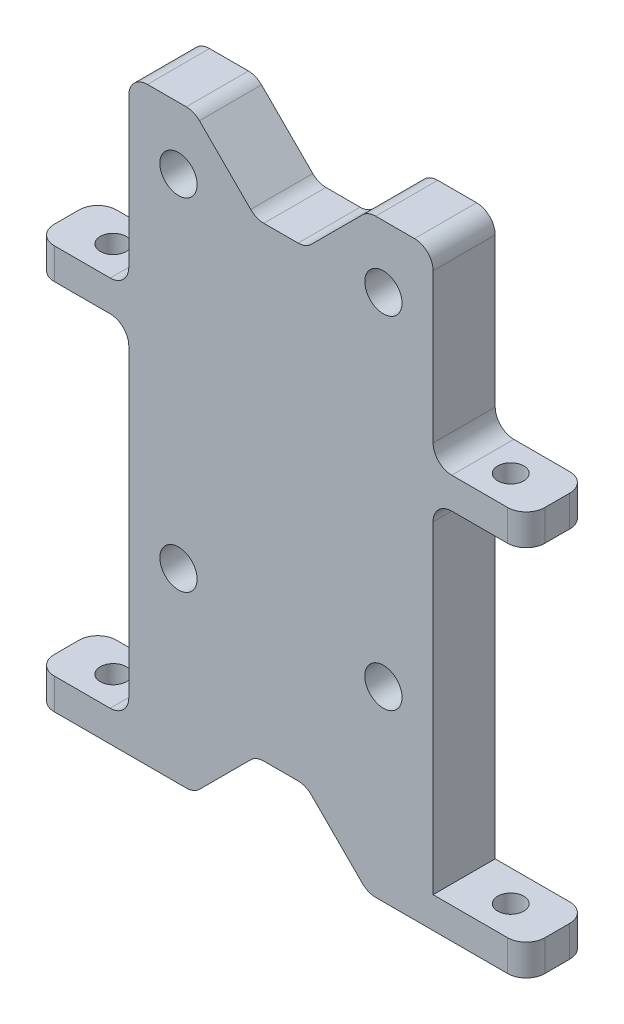
from build123d import *

# Parameters (mm, degrees)
SKETCH1_R           = 3
BOSS_EXTRUDE1_DEPTH = 10
SKETCH2_W           = 10
SKETCH2_H           = 5
BOSS_EXTRUDE2_DEPTH = 15
SKETCH3_R           = 2.1
CUT_EXTRUDE1_DEPTH  = 64
FILLET1_R           = 3
BOSS_EXTRUDE3_START = -10
BOSS_EXTRUDE3_DEPTH = 10
MIRROR3_START       = -58.554872108
MIRROR3_OUTLINE_W   = 15
MIRROR3_OUTLINE_H   = 10
MIRROR3_OUTLINE_R   = 2.1
MIRROR3_DEPTH       = 5
MIRROR3_2_DEPTH     = 10
FILLET2_R           = 3
SKETCH5_W           = 15
SKETCH5_H           = 11
CUT_EXTRUDE2_DEPTH  = 80.749736613
FILLET3_R           = 3
MIRROR4_START       = 1.445127892
MIRROR4_OUTLINE_R   = 2.1
MIRROR4_DEPTH       = 5
MIRROR4_2_DEPTH     = 10
FILLET4_R           = 3
SKETCH6_W           = 15
SKETCH6_H           = 11
CUT_EXTRUDE3_DEPTH  = 80.749736613
CUT_EXTRUDE4_DEPTH  = 80.749736613


with BuildPart() as part:
    # Sketch1 → Boss-Extrude1 (new body)
    with BuildSketch(Plane.XY):
        with BuildLine():
            Line((-24.5, 33.445127892), (-24.5, -35.554872108))
            ThreePointArc((-24.5, -35.554872108), (-23.621320344, -37.676192452), (-21.5, -38.554872108))
            Line((-21.5, -38.554872108), (-15.242640687, -38.554872108))
            ThreePointArc((-15.242640687, -38.554872108), (-14.09459039, -38.326510706), (-13.121320344, -37.676192452))
            Line((-13.121320344, -37.676192452), (-4.878679656, -29.433551765))
            ThreePointArc((-4.878679656, -29.433551765), (-3.90540961, -28.783233511), (-2.757359313, -28.554872108))
            Line((-2.757359313, -28.554872108), (2.757359313, -28.554872108))
            ThreePointArc((2.757359313, -28.554872108), (3.90540961, -28.783233511), (4.878679656, -29.433551765))
            Line((4.878679656, -29.433551765), (13.121320344, -37.676192452))
            ThreePointArc((13.121320344, -37.676192452), (14.09459039, -38.326510706), (15.242640687, -38.554872108))
            Line((15.242640687, -38.554872108), (21.5, -38.554872108))
            ThreePointArc((21.5, -38.554872108), (23.621320344, -37.676192452), (24.5, -35.554872108))
            Line((24.5, -35.554872108), (24.5, 33.445127892))
            ThreePointArc((24.5, 33.445127892), (23.621320344, 35.566448235), (21.5, 36.445127892))
            Line((21.5, 36.445127892), (15.242640687, 36.445127892))
            ThreePointArc((15.242640687, 36.445127892), (14.09459039, 36.216766489), (13.121320344, 35.566448235))
            Line((13.121320344, 35.566448235), (4.878679656, 27.323807548))
            ThreePointArc((4.878679656, 27.323807548), (3.90540961, 26.673489294), (2.757359313, 26.445127892))
            Line((2.757359313, 26.445127892), (-2.757359313, 26.445127892))
            ThreePointArc((-2.757359313, 26.445127892), (-3.90540961, 26.673489294), (-4.878679656, 27.323807548))
            Line((-4.878679656, 27.323807548), (-13.121320344, 35.566448235))
            ThreePointArc((-13.121320344, 35.566448235), (-14.09459039, 36.216766489), (-15.242640687, 36.445127892))
            Line((-15.242640687, 36.445127892), (-21.5, 36.445127892))
            ThreePointArc((-21.5, 36.445127892), (-23.621320344, 35.566448235), (-24.5, 33.445127892))
        make_face()
        with Locations((16.5, -28.554872108)):
            Circle(SKETCH1_R, mode=Mode.SUBTRACT)
        with Locations((-16.5, -28.554872108)):
            Circle(SKETCH1_R, mode=Mode.SUBTRACT)
        with Locations((16.5, 26.445127892)):
            Circle(SKETCH1_R, mode=Mode.SUBTRACT)
        with Locations((-16.5, 26.445127892)):
            Circle(SKETCH1_R, mode=Mode.SUBTRACT)
    extrude(amount=BOSS_EXTRUDE1_DEPTH)

    # Sketch2 → Boss-Extrude2 (add)
    with BuildSketch(Plane(origin=(24.5, 0, 0), x_dir=(0, 0, -1), z_dir=(1, 0, 0))):
        with Locations((-5, 23.945127892)):
            Rectangle(SKETCH2_W, SKETCH2_H)
        with Locations((-5, -26.054872108)):
            Rectangle(SKETCH2_W, SKETCH2_H)
    boss_extrude2 = extrude(amount=BOSS_EXTRUDE2_DEPTH)

    # Sketch3 → Cut-Extrude1 (cut)
    with BuildSketch(Plane(origin=(0, 26.445127892, 0), x_dir=(1, 0, 0), z_dir=(0, 1, 0))):
        with Locations(Location((32, -5, 0), (0, 0, 180))):
            Circle(SKETCH3_R)
    cut_extrude1 = extrude(amount=-CUT_EXTRUDE1_DEPTH, mode=Mode.SUBTRACT)

    # Mirror1: Boss-Extrude2, Cut-Extrude1 across plane
    add(boss_extrude2.mirror(Plane(origin=(0, 0, 0), x_dir=(0, 0, 1), z_dir=(1, 0, 0))))
    add(cut_extrude1.mirror(Plane(origin=(0, 0, 0), x_dir=(0, 0, 1), z_dir=(1, 0, 0))), mode=Mode.SUBTRACT)

    # Fillet1
    fillet1_edges = [part.edges().sort_by_distance(p)[0] for p in [
        (-39.5, 23.945127892, 10),
        (-39.5, 23.945127892, 0),
        (-24.5, 21.445127892, 5),
        (-24.5, 26.445127892, 5),
        (-39.5, -26.054872108, 10),
        (-39.5, -26.054872108, 0),
        (-24.5, -28.554872108, 5),
        (-24.5, -23.554872108, 5),
        (24.5, 21.445127892, 5),
        (24.5, 26.445127892, 5),
        (39.5, 23.945127892, 10),
        (39.5, 23.945127892, 0),
        (24.5, -28.554872108, 5),
        (24.5, -23.554872108, 5),
        (39.5, -26.054872108, 10),
        (39.5, -26.054872108, 0),
    ]]
    fillet(fillet1_edges, radius=FILLET1_R)

    # Sketch4 → Boss-Extrude3 (add)
    with BuildSketch(Plane.XY.offset(10).offset(BOSS_EXTRUDE3_START)):
        with BuildLine():
            ThreePointArc((15.242640687, -68.554872108), (14.09459039, -68.326510706), (13.121320344, -67.676192452))
            Line((13.121320344, -67.676192452), (4.878679656, -59.433551765))
            ThreePointArc((4.878679656, -59.433551765), (3.90540961, -58.783233511), (2.757359313, -58.554872108))
            Line((2.757359313, -58.554872108), (-2.757359313, -58.554872108))
            ThreePointArc((-2.757359313, -58.554872108), (-3.90540961, -58.783233511), (-4.878679656, -59.433551765))
            Line((-4.878679656, -59.433551765), (-13.121320344, -67.676192452))
            ThreePointArc((-13.121320344, -67.676192452), (-14.09459039, -68.326510706), (-15.242640687, -68.554872108))
            Line((-15.242640687, -68.554872108), (-24.5, -68.554872108))
            Line((-24.5, -68.554872108), (-24.5, -38.554872108))
            Line((-24.5, -38.554872108), (-24.5, -35.554872108))
            ThreePointArc((-24.5, -35.554872108), (-23.621320344, -37.676192452), (-21.5, -38.554872108))
            Line((-21.5, -38.554872108), (-15.242640687, -38.554872108))
            ThreePointArc((-15.242640687, -38.554872108), (-14.09459039, -38.326510706), (-13.121320344, -37.676192452))
            Line((-13.121320344, -37.676192452), (-4.878679656, -29.433551765))
            ThreePointArc((-4.878679656, -29.433551765), (-3.90540961, -28.783233511), (-2.757359313, -28.554872108))
            Line((-2.757359313, -28.554872108), (2.757359313, -28.554872108))
            ThreePointArc((2.757359313, -28.554872108), (3.90540961, -28.783233511), (4.878679656, -29.433551765))
            Line((4.878679656, -29.433551765), (13.121320344, -37.676192452))
            ThreePointArc((13.121320344, -37.676192452), (14.09459039, -38.326510706), (15.242640687, -38.554872108))
            Line((15.242640687, -38.554872108), (21.5, -38.554872108))
            ThreePointArc((21.5, -38.554872108), (23.621320344, -37.676192452), (24.5, -35.554872108))
            Line((24.5, -35.554872108), (24.5, -38.554872108))
            Line((24.5, -38.554872108), (24.5, -68.554872108))
            Line((24.5, -68.554872108), (15.242640687, -68.554872108))
        make_face()
    extrude(amount=BOSS_EXTRUDE3_DEPTH)

    # Mirror3: read off the stored shape, not the designer's step
    # Mirror3 outline → Mirror3 (add)
    # profile 1 of 2: a face of its own
    with BuildSketch(Plane(origin=(0, 0, 0), x_dir=(1, 0, 0), z_dir=(0, 1, 0)).offset(MIRROR3_START)):
        with Locations((32, -5)):
            Rectangle(MIRROR3_OUTLINE_W, MIRROR3_OUTLINE_H)
        with Locations((32, -5)):
            Circle(MIRROR3_OUTLINE_R, mode=Mode.SUBTRACT)
    # profile 2 of 2: a face of its own
    with BuildSketch(Plane(origin=(0, 0, 0), x_dir=(1, 0, 0), z_dir=(0, 1, 0)).offset(MIRROR3_START)):
        with Locations((-32, -5)):
            Rectangle(MIRROR3_OUTLINE_W, MIRROR3_OUTLINE_H)
        with Locations((-32, -5)):
            Circle(MIRROR3_OUTLINE_R, mode=Mode.SUBTRACT)
    extrude(amount=MIRROR3_DEPTH)

    # Mirror3 2 outline → Mirror3 2 (add)
    with BuildSketch(Plane.XY):
        with BuildLine():
            ThreePointArc((-24.5, -50.554872108), (-25.378679656, -52.676192452), (-27.5, -53.554872108))
            Line((-27.5, -53.554872108), (-24.5, -53.554872108))
            Line((-24.5, -53.554872108), (-24.5, -50.554872108))
        make_face()
        with BuildLine():
            Line((-24.5, -58.554872108), (-27.5, -58.554872108))
            ThreePointArc((-27.5, -58.554872108), (-25.378679657, -59.433551764), (-24.5, -61.554872108))
            Line((-24.5, -61.554872108), (-24.5, -58.554872108))
        make_face()
    extrude(amount=MIRROR3_2_DEPTH)

    # Fillet2
    fillet2_edges = [part.edges().sort_by_distance(p)[0] for p in [
        (-39.5, -56.054872108, 10),
        (-39.5, -56.054872108, 0),
        (39.5, -56.054872108, 10),
        (39.5, -56.054872108, 0),
    ]]
    fillet(fillet2_edges, radius=FILLET2_R)

    # Sketch5 → Cut-Extrude2 (cut, through all)
    with BuildSketch(Plane.XY.offset(10)):
        with Locations((-32, -26.054872108)):
            Rectangle(SKETCH5_W, SKETCH5_H)
        with Locations((32, -26.054872108)):
            Rectangle(SKETCH5_W, SKETCH5_H)
    extrude(amount=-CUT_EXTRUDE2_DEPTH, mode=Mode.SUBTRACT)

    # Fillet3
    fillet3_edges = [part.edges().sort_by_distance(p)[0] for p in [
        (-24.5, -68.554872108, 5),
        (24.5, -68.554872108, 5),
    ]]
    fillet(fillet3_edges, radius=FILLET3_R)

    # Mirror4: read off the stored shape, not the designer's step
    # Mirror4 outline → Mirror4 (add)
    with BuildSketch(Plane(origin=(0, 0, 0), x_dir=(1, 0, 0), z_dir=(0, 1, 0)).offset(MIRROR4_START)):
        with BuildLine():
            ThreePointArc((-39.5, -7), (-38.621320344, -9.121320344), (-36.5, -10))
            Line((-36.5, -10), (39.5, -10))
            Line((39.5, -10), (39.5, 0))
            Line((39.5, 0), (-36.5, 0))
            ThreePointArc((-36.5, 0), (-38.621320344, -0.878679656), (-39.5, -3))
            Line((-39.5, -3), (-39.5, -7))
        make_face()
        with Locations((-32, -5)):
            Circle(MIRROR4_OUTLINE_R, mode=Mode.SUBTRACT)
        with Locations((32, -5)):
            Circle(MIRROR4_OUTLINE_R, mode=Mode.SUBTRACT)
    extrude(amount=MIRROR4_DEPTH)

    # Mirror4 2 outline → Mirror4 2 (add)
    with BuildSketch(Plane.XY):
        with BuildLine():
            ThreePointArc((-24.5, 9.445127892), (-25.378679656, 7.323807548), (-27.5, 6.445127892))
            Line((-27.5, 6.445127892), (-24.5, 6.445127892))
            Line((-24.5, 6.445127892), (-24.5, 9.445127892))
        make_face()
        with BuildLine():
            Line((-24.5, 1.445127892), (-27.5, 1.445127892))
            ThreePointArc((-27.5, 1.445127892), (-25.378679657, 0.566448236), (-24.5, -1.554872108))
            Line((-24.5, -1.554872108), (-24.5, 1.445127892))
        make_face()
    extrude(amount=MIRROR4_2_DEPTH)

    # Fillet4
    fillet4_edges = [part.edges().sort_by_distance(p)[0] for p in [
        (39.5, 3.945127892, 10),
        (39.5, 3.945127892, 0),
        (24.5, 6.445127892, 5),
        (24.5, 1.445127892, 5),
    ]]
    fillet(fillet4_edges, radius=FILLET4_R)

    # Sketch6 → Cut-Extrude3 (cut, through all)
    with BuildSketch(Plane.XY.offset(10)):
        with Locations((-32, 23.945127892)):
            Rectangle(SKETCH6_W, SKETCH6_H)
        with Locations((32, 23.945127892)):
            Rectangle(SKETCH6_W, SKETCH6_H)
    extrude(amount=-CUT_EXTRUDE3_DEPTH, mode=Mode.SUBTRACT)

    # Sketch7 → Cut-Extrude4 (cut, through all)
    with BuildSketch(Plane.XY.offset(10)):
        with BuildLine():
            Line((15.242640687, -58.554872108), (24.5, -58.554872108))
            Line((24.5, -58.554872108), (24.5, -65.554872108))
            ThreePointArc((24.5, -65.554872108), (23.621320344, -67.676192452), (21.5, -68.554872108))
            Line((21.5, -68.554872108), (15.242640687, -68.554872108))
            ThreePointArc((15.242640687, -68.554872108), (14.09459039, -68.326510706), (13.121320344, -67.676192452))
            Line((13.121320344, -67.676192452), (4.878679656, -59.433551765))
            ThreePointArc((4.878679656, -59.433551765), (3.90540961, -58.783233511), (2.757359313, -58.554872108))
            Line((2.757359313, -58.554872108), (-2.757359313, -58.554872108))
            ThreePointArc((-2.757359313, -58.554872108), (-3.90540961, -58.783233511), (-4.878679656, -59.433551765))
            Line((-4.878679656, -59.433551765), (-13.121320344, -67.676192452))
            ThreePointArc((-13.121320344, -67.676192452), (-14.09459039, -68.326510706), (-15.242640687, -68.554872108))
            Line((-15.242640687, -68.554872108), (-21.5, -68.554872108))
            ThreePointArc((-21.5, -68.554872108), (-23.621320344, -67.676192452), (-24.5, -65.554872108))
            Line((-24.5, -65.554872108), (-24.5, -61.554872108))
            ThreePointArc((-24.5, -61.554872108), (-25.378679656, -59.433551765), (-27.5, -58.554872108))
            Line((-27.5, -58.554872108), (-15.242640687, -58.554872108))
            ThreePointArc((-15.242640687, -58.554872108), (-14.09459039, -58.326510706), (-13.121320344, -57.676192452))
            Line((-13.121320344, -57.676192452), (-4.878679656, -49.433551765))
            ThreePointArc((-4.878679656, -49.433551765), (-3.90540961, -48.783233511), (-2.757359313, -48.554872108))
            Line((-2.757359313, -48.554872108), (2.757359313, -48.554872108))
            ThreePointArc((2.757359313, -48.554872108), (3.90540961, -48.783233511), (4.878679656, -49.433551765))
            Line((4.878679656, -49.433551765), (13.121320344, -57.676192452))
            ThreePointArc((13.121320344, -57.676192452), (14.09459039, -58.326510706), (15.242640687, -58.554872108))
        make_face()
    extrude(amount=-CUT_EXTRUDE4_DEPTH, mode=Mode.SUBTRACT)


solid = part.part
